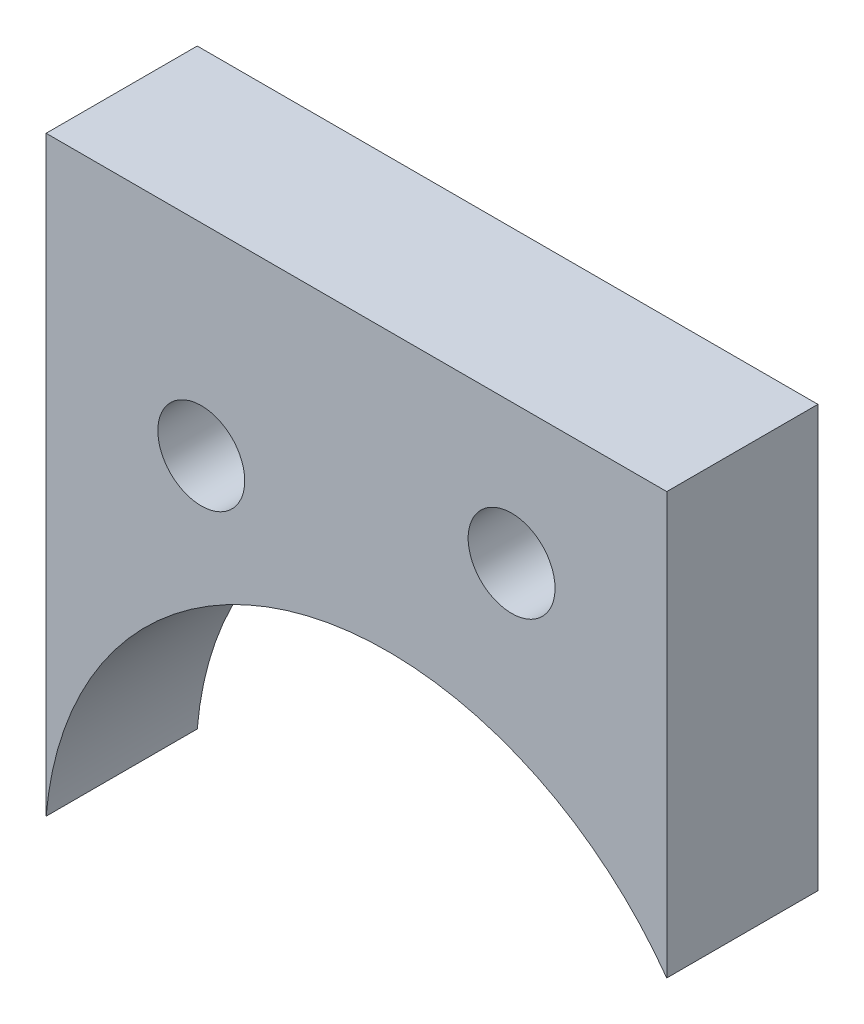
from build123d import *

# Parameters (mm, degrees)
SKETCH1_R           = 1.4
BOSS_EXTRUDE1_DEPTH = 4.87


with BuildPart() as part:
    # Sketch1 → Boss-Extrude1 (new body)
    with BuildSketch(Plane.XY):
        with BuildLine():
            Line((0, 0.939361485), (0, 20))
            Line((0, 20), (20, 20))
            Line((20, 20), (20, 6.425138131))
            ThreePointArc((20, 6.425138131), (8.087067166, 10.656404818), (0, 0.939361485))
        make_face()
        with Locations((5, 13.5)):
            Circle(SKETCH1_R, mode=Mode.SUBTRACT)
        with Locations((15, 15.5)):
            Circle(SKETCH1_R, mode=Mode.SUBTRACT)
    extrude(amount=BOSS_EXTRUDE1_DEPTH)


solid = part.part
